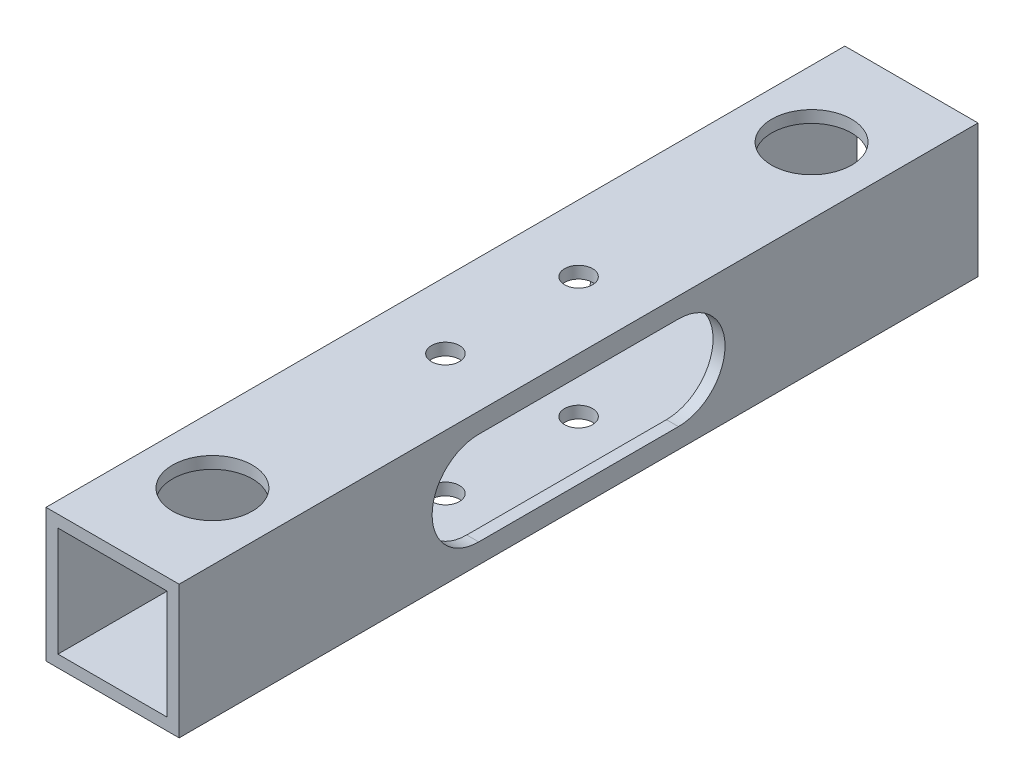
from build123d import *

# Parameters (mm, degrees)
SKETCH_3_W              = 20
SKETCH_3_H              = 20
SKETCH_3_W_2            = 16.4
SKETCH_3_H_2            = 16.4
EXTRUDE_1_DEPTH         = 120
HOLE_WIZARD_4_2_4_2_1_D = 4.2
CUT_EXTRUDE_START       = -20
CUT_EXTRUDE_1_DEPTH     = 20
CUT_EXTRUDE_2_REACH     = 125.288
SKETCH_8_R              = 6


# Read off the part's stored shape, not the designer's step: 切除-拉伸1
with BuildPart() as part:
    # 草图3 → 凸台-拉伸1 (new body)
    with BuildSketch(Plane.XY):
        with Locations((10, 10)):
            Rectangle(SKETCH_3_W, SKETCH_3_H)
        with Locations((10, 10)):
            Rectangle(SKETCH_3_W_2, SKETCH_3_H_2, mode=Mode.SUBTRACT)
    extrude(amount=-EXTRUDE_1_DEPTH)

    # Ø4.2 (4.2) 直径孔1 (through all)
    with Locations(Plane(origin=(10, 0, -105), x_dir=(0, 0, -1), z_dir=(0, -1, 0))):
        with Locations((0, 0), (-35, 0), (-55, 0), (-90, 0)):
            Hole(HOLE_WIZARD_4_2_4_2_1_D / 2)

    # 切除-拉伸1 outline → 切除-拉伸1 (cut)
    with BuildSketch(Plane(origin=(20, 0, 0), x_dir=(0, 0, -1), z_dir=(1, 0, 0)).offset(CUT_EXTRUDE_START)):
        with BuildLine():
            ThreePointArc((45, 17), (38, 10), (45, 3))
            Line((45, 3), (75, 3))
            ThreePointArc((75, 3), (82, 10), (75, 17))
            Line((75, 17), (45, 17))
        make_face()
    extrude(amount=CUT_EXTRUDE_1_DEPTH, mode=Mode.SUBTRACT)

    # 草图8 → 切除-拉伸2 (cut, up to next)
    with BuildSketch(Plane.XZ.offset(-20), mode=Mode.PRIVATE) as cut_extrude_2_sk1:
        with Locations(Location((10, -105, 0), (0, 0, 90))):
            Circle(SKETCH_8_R)
    cut_extrude_2_tool1 = extrude(cut_extrude_2_sk1.sketch, amount=CUT_EXTRUDE_2_REACH, mode=Mode.PRIVATE) & part.part
    # 草图8 → 切除-拉伸2 (cut, up to next)
    with BuildSketch(Plane.XZ.offset(-20), mode=Mode.PRIVATE) as cut_extrude_2_sk2:
        with Locations(Location((10, -15, 0), (0, 0, 90))):
            Circle(SKETCH_8_R)
    cut_extrude_2_tool2 = extrude(cut_extrude_2_sk2.sketch, amount=CUT_EXTRUDE_2_REACH, mode=Mode.PRIVATE) & part.part
    add(cut_extrude_2_tool1.solids().sort_by_distance((10, 20, -105))[0], mode=Mode.SUBTRACT)
    add(cut_extrude_2_tool2.solids().sort_by_distance((10, 20, -15))[0], mode=Mode.SUBTRACT)


solid = part.part
